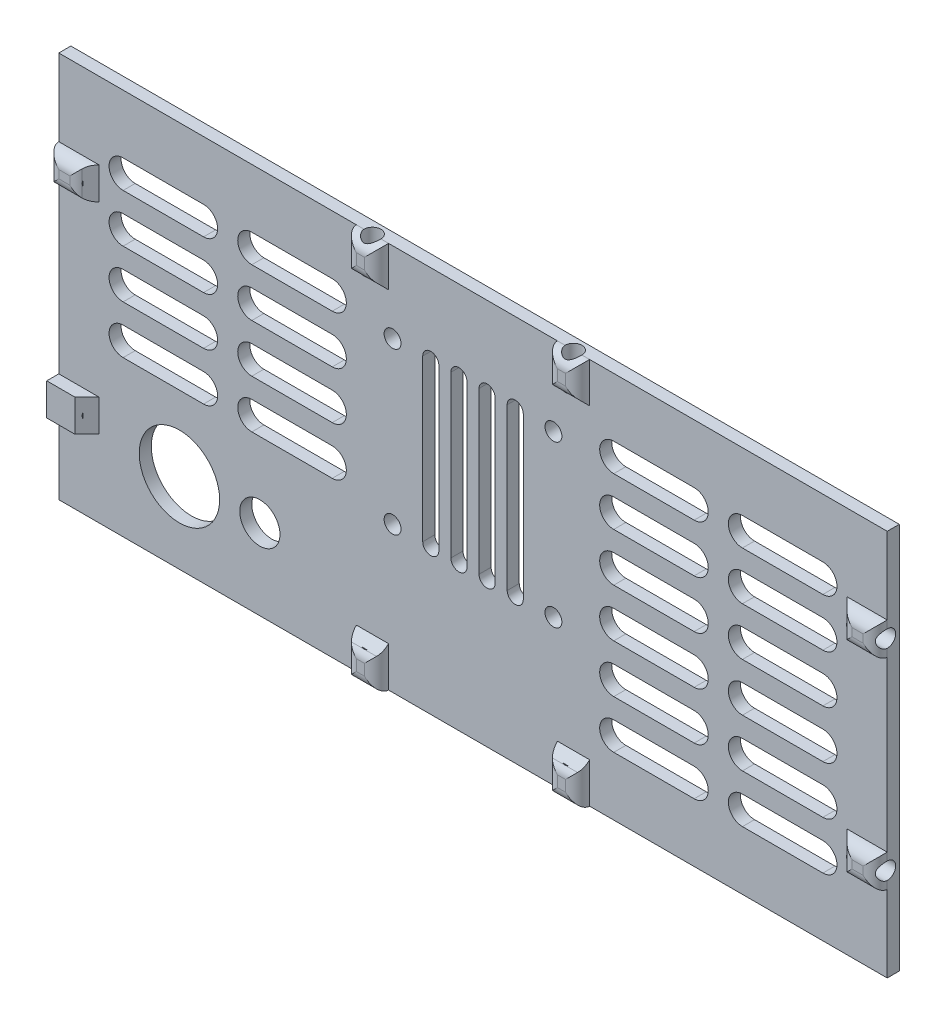
from build123d import *

# Parameters (mm, degrees)
SKETCH1_W           = 96.2019
SKETCH1_H           = 206
SKETCH1_R           = 2.1
SKETCH1_R_2         = 10
SKETCH1_R_3         = 5
BOSS_EXTRUDE1_DEPTH = 3
BOSS_EXTRUDE6_DEPTH = 10
BOSS_EXTRUDE7_START = -96.2019
BOSS_EXTRUDE7_DEPTH = 10
BOSS_EXTRUDE3_DEPTH = 10
BOSS_EXTRUDE4_START = -206
BOSS_EXTRUDE4_DEPTH = 10
CUT_EXTRUDE4_START  = -206
CUT_EXTRUDE4_DEPTH  = 8
CUT_EXTRUDE5_START  = -8
CUT_EXTRUDE5_DEPTH  = 8
CUT_EXTRUDE6_DEPTH  = 8
CUT_EXTRUDE7_START  = -88.2019
CUT_EXTRUDE7_DEPTH  = 8
CHAMFER1_SIZE       = 3
FILLET1_R           = 3


# Some blends are built 0.0001 mm under size
with BuildPart() as part:
    # Sketch1 → Boss-Extrude1 (new body)
    with BuildSketch(Plane(origin=(0, 0, 0), x_dir=(0, 1, 0), z_dir=(0, 0, 1))):
        with Locations((48.10095, 103)):
            Rectangle(SKETCH1_W, SKETCH1_H)
        with Locations(Location((36.2019, 123, 0), (0, 0, 270))):
            Circle(SKETCH1_R, mode=Mode.SUBTRACT)
        with Locations(Location((76.2019, 123, 0), (0, 0, 270))):
            Circle(SKETCH1_R, mode=Mode.SUBTRACT)
        with Locations(Location((36.2019, 83, 0), (0, 0, 270))):
            Circle(SKETCH1_R, mode=Mode.SUBTRACT)
        with Locations(Location((76.2019, 83, 0), (0, 0, 270))):
            Circle(SKETCH1_R, mode=Mode.SUBTRACT)
        with Locations(Location((20, 176, 0), (0, 0, 270))):
            Circle(SKETCH1_R_2, mode=Mode.SUBTRACT)
        with Locations(Location((20, 156, 0), (0, 0, 270))):
            Circle(SKETCH1_R_3, mode=Mode.SUBTRACT)
        with BuildLine():
            Line((36.2019, 115.5), (76.2019, 115.5))
            ThreePointArc((76.2019, 115.5), (78.2019, 113.5), (76.2019, 111.5))
            Line((76.2019, 111.5), (36.2019, 111.5))
            ThreePointArc((36.2019, 111.5), (34.2019, 113.5), (36.2019, 115.5))
        make_face(mode=Mode.SUBTRACT)
        with BuildLine():
            Line((36.2019, 108.5), (76.2019, 108.5))
            ThreePointArc((76.2019, 108.5), (78.2019, 106.5), (76.2019, 104.5))
            Line((76.2019, 104.5), (36.2019, 104.5))
            ThreePointArc((36.2019, 104.5), (34.2019, 106.5), (36.2019, 108.5))
        make_face(mode=Mode.SUBTRACT)
        with BuildLine():
            Line((36.2019, 101.5), (76.2019, 101.5))
            ThreePointArc((76.2019, 101.5), (78.2019, 99.5), (76.2019, 97.5))
            Line((76.2019, 97.5), (36.2019, 97.5))
            ThreePointArc((36.2019, 97.5), (34.2019, 99.5), (36.2019, 101.5))
        make_face(mode=Mode.SUBTRACT)
        with BuildLine():
            Line((36.2019, 94.5), (76.2019, 94.5))
            ThreePointArc((76.2019, 94.5), (78.2019, 92.5), (76.2019, 90.5))
            Line((76.2019, 90.5), (36.2019, 90.5))
            ThreePointArc((36.2019, 90.5), (34.2019, 92.5), (36.2019, 94.5))
        make_face(mode=Mode.SUBTRACT)
        with BuildLine():
            Line((21.60095, 68), (21.60095, 48))
            ThreePointArc((21.60095, 48), (18.10095, 44.5), (14.60095, 48))
            Line((14.60095, 48), (14.60095, 68))
            ThreePointArc((14.60095, 68), (18.10095, 71.5), (21.60095, 68))
        make_face(mode=Mode.SUBTRACT)
        with BuildLine():
            Line((33.60095, 68), (33.60095, 48))
            ThreePointArc((33.60095, 48), (30.10095, 44.5), (26.60095, 48))
            Line((26.60095, 48), (26.60095, 68))
            ThreePointArc((26.60095, 68), (30.10095, 71.5), (33.60095, 68))
        make_face(mode=Mode.SUBTRACT)
        with BuildLine():
            Line((45.60095, 68), (45.60095, 48))
            ThreePointArc((45.60095, 48), (42.10095, 44.5), (38.60095, 48))
            Line((38.60095, 48), (38.60095, 68))
            ThreePointArc((38.60095, 68), (42.10095, 71.5), (45.60095, 68))
        make_face(mode=Mode.SUBTRACT)
        with BuildLine():
            Line((57.60095, 68), (57.60095, 48))
            ThreePointArc((57.60095, 48), (54.10095, 44.5), (50.60095, 48))
            Line((50.60095, 48), (50.60095, 68))
            ThreePointArc((50.60095, 68), (54.10095, 71.5), (57.60095, 68))
        make_face(mode=Mode.SUBTRACT)
        with BuildLine():
            Line((69.60095, 68), (69.60095, 48))
            ThreePointArc((69.60095, 48), (66.10095, 44.5), (62.60095, 48))
            Line((62.60095, 48), (62.60095, 68))
            ThreePointArc((62.60095, 68), (66.10095, 71.5), (69.60095, 68))
        make_face(mode=Mode.SUBTRACT)
        with BuildLine():
            Line((81.60095, 68), (81.60095, 48))
            ThreePointArc((81.60095, 48), (78.10095, 44.5), (74.60095, 48))
            Line((74.60095, 48), (74.60095, 68))
            ThreePointArc((74.60095, 68), (78.10095, 71.5), (81.60095, 68))
        make_face(mode=Mode.SUBTRACT)
        with BuildLine():
            Line((21.60095, 16), (21.60095, 36))
            ThreePointArc((21.60095, 36), (18.10095, 39.5), (14.60095, 36))
            Line((14.60095, 36), (14.60095, 16))
            ThreePointArc((14.60095, 16), (18.10095, 12.5), (21.60095, 16))
        make_face(mode=Mode.SUBTRACT)
        with BuildLine():
            Line((33.60095, 16), (33.60095, 36))
            ThreePointArc((33.60095, 36), (30.10095, 39.5), (26.60095, 36))
            Line((26.60095, 36), (26.60095, 16))
            ThreePointArc((26.60095, 16), (30.10095, 12.5), (33.60095, 16))
        make_face(mode=Mode.SUBTRACT)
        with BuildLine():
            Line((45.60095, 16), (45.60095, 36))
            ThreePointArc((45.60095, 36), (42.10095, 39.5), (38.60095, 36))
            Line((38.60095, 36), (38.60095, 16))
            ThreePointArc((38.60095, 16), (42.10095, 12.5), (45.60095, 16))
        make_face(mode=Mode.SUBTRACT)
        with BuildLine():
            Line((57.60095, 16), (57.60095, 36))
            ThreePointArc((57.60095, 36), (54.10095, 39.5), (50.60095, 36))
            Line((50.60095, 36), (50.60095, 16))
            ThreePointArc((50.60095, 16), (54.10095, 12.5), (57.60095, 16))
        make_face(mode=Mode.SUBTRACT)
        with BuildLine():
            Line((69.60095, 16), (69.60095, 36))
            ThreePointArc((69.60095, 36), (66.10095, 39.5), (62.60095, 36))
            Line((62.60095, 36), (62.60095, 16))
            ThreePointArc((62.60095, 16), (66.10095, 12.5), (69.60095, 16))
        make_face(mode=Mode.SUBTRACT)
        with BuildLine():
            Line((81.60095, 16), (81.60095, 36))
            ThreePointArc((81.60095, 36), (78.10095, 39.5), (74.60095, 36))
            Line((74.60095, 36), (74.60095, 16))
            ThreePointArc((74.60095, 16), (78.10095, 12.5), (81.60095, 16))
        make_face(mode=Mode.SUBTRACT)
        with BuildLine():
            Line((45.60095, 138), (45.60095, 158))
            ThreePointArc((45.60095, 158), (42.10095, 161.5), (38.60095, 158))
            Line((38.60095, 158), (38.60095, 138))
            ThreePointArc((38.60095, 138), (42.10095, 134.5), (45.60095, 138))
        make_face(mode=Mode.SUBTRACT)
        with BuildLine():
            Line((57.60095, 138), (57.60095, 158))
            ThreePointArc((57.60095, 158), (54.10095, 161.5), (50.60095, 158))
            Line((50.60095, 158), (50.60095, 138))
            ThreePointArc((50.60095, 138), (54.10095, 134.5), (57.60095, 138))
        make_face(mode=Mode.SUBTRACT)
        with BuildLine():
            Line((69.60095, 138), (69.60095, 158))
            ThreePointArc((69.60095, 158), (66.10095, 161.5), (62.60095, 158))
            Line((62.60095, 158), (62.60095, 138))
            ThreePointArc((62.60095, 138), (66.10095, 134.5), (69.60095, 138))
        make_face(mode=Mode.SUBTRACT)
        with BuildLine():
            Line((81.60095, 138), (81.60095, 158))
            ThreePointArc((81.60095, 158), (78.10095, 161.5), (74.60095, 158))
            Line((74.60095, 158), (74.60095, 138))
            ThreePointArc((74.60095, 138), (78.10095, 134.5), (81.60095, 138))
        make_face(mode=Mode.SUBTRACT)
        with BuildLine():
            Line((45.60095, 190), (45.60095, 170))
            ThreePointArc((45.60095, 170), (42.10095, 166.5), (38.60095, 170))
            Line((38.60095, 170), (38.60095, 190))
            ThreePointArc((38.60095, 190), (42.10095, 193.5), (45.60095, 190))
        make_face(mode=Mode.SUBTRACT)
        with BuildLine():
            Line((57.60095, 190), (57.60095, 170))
            ThreePointArc((57.60095, 170), (54.10095, 166.5), (50.60095, 170))
            Line((50.60095, 170), (50.60095, 190))
            ThreePointArc((50.60095, 190), (54.10095, 193.5), (57.60095, 190))
        make_face(mode=Mode.SUBTRACT)
        with BuildLine():
            Line((69.60095, 190), (69.60095, 170))
            ThreePointArc((69.60095, 170), (66.10095, 166.5), (62.60095, 170))
            Line((62.60095, 170), (62.60095, 190))
            ThreePointArc((62.60095, 190), (66.10095, 193.5), (69.60095, 190))
        make_face(mode=Mode.SUBTRACT)
        with BuildLine():
            Line((81.60095, 190), (81.60095, 170))
            ThreePointArc((81.60095, 170), (78.10095, 166.5), (74.60095, 170))
            Line((74.60095, 170), (74.60095, 190))
            ThreePointArc((74.60095, 190), (78.10095, 193.5), (81.60095, 190))
        make_face(mode=Mode.SUBTRACT)
    extrude(amount=BOSS_EXTRUDE1_DEPTH)

    # Sketch2<4> → Boss-Extrude6 (add)
    with BuildSketch(Plane.XZ):
        with BuildLine():
            Line((-82, 6), (-82, 3))
            Line((-82, 3), (-80.1, 3))
            ThreePointArc((-80.1, 3), (-78, 5.1), (-75.9, 3))
            Line((-75.9, 3), (-74, 3))
            Line((-74, 3), (-74, 6))
            Line((-74, 6), (-82, 6))
        make_face()
        with BuildLine():
            Line((-80.1, 3), (-82, 3))
            Line((-82, 3), (-82, 0))
            Line((-82, 0), (-74, 0))
            Line((-74, 0), (-74, 3))
            Line((-74, 3), (-75.9, 3))
            ThreePointArc((-75.9, 3), (-78, 0.9), (-80.1, 3))
        make_face()
        with BuildLine():
            Line((-75.9, 3), (-80.1, 3))
            ThreePointArc((-80.1, 3), (-78, 0.9), (-75.9, 3))
        make_face()
        with BuildLine():
            ThreePointArc((-75.9, 3), (-78, 5.1), (-80.1, 3))
            Line((-80.1, 3), (-75.9, 3))
        make_face()
        with BuildLine():
            Line((-124, 6), (-132, 6))
            Line((-132, 6), (-132, 3))
            Line((-132, 3), (-130.1, 3))
            ThreePointArc((-130.1, 3), (-128, 5.1), (-125.9, 3))
            Line((-125.9, 3), (-124, 3))
            Line((-124, 3), (-124, 6))
        make_face()
        with BuildLine():
            Line((-130.1, 3), (-132, 3))
            Line((-132, 3), (-132, 0))
            Line((-132, 0), (-124, 0))
            Line((-124, 0), (-124, 3))
            Line((-124, 3), (-125.9, 3))
            ThreePointArc((-125.9, 3), (-128, 0.9), (-130.1, 3))
        make_face()
        with BuildLine():
            Line((-125.9, 3), (-130.1, 3))
            ThreePointArc((-130.1, 3), (-128, 0.9), (-125.9, 3))
        make_face()
        with BuildLine():
            ThreePointArc((-125.9, 3), (-128, 5.1), (-130.1, 3))
            Line((-130.1, 3), (-125.9, 3))
        make_face()
    extrude(amount=-BOSS_EXTRUDE6_DEPTH)

    # Sketch2 → Boss-Extrude7 (add)
    with BuildSketch(Plane.XZ.offset(BOSS_EXTRUDE7_START)):
        with BuildLine():
            Line((-124, 6), (-132, 6))
            Line((-132, 6), (-132, 3))
            Line((-132, 3), (-130.1, 3))
            ThreePointArc((-130.1, 3), (-128, 5.1), (-125.9, 3))
            Line((-125.9, 3), (-124, 3))
            Line((-124, 3), (-124, 6))
        make_face()
        with BuildLine():
            Line((-130.1, 3), (-132, 3))
            Line((-132, 3), (-132, 0))
            Line((-132, 0), (-124, 0))
            Line((-124, 0), (-124, 3))
            Line((-124, 3), (-125.9, 3))
            ThreePointArc((-125.9, 3), (-128, 0.9), (-130.1, 3))
        make_face()
        with BuildLine():
            Line((-125.9, 3), (-130.1, 3))
            ThreePointArc((-130.1, 3), (-128, 0.9), (-125.9, 3))
        make_face()
        with BuildLine():
            ThreePointArc((-125.9, 3), (-128, 5.1), (-130.1, 3))
            Line((-130.1, 3), (-125.9, 3))
        make_face()
        with BuildLine():
            Line((-80.1, 3), (-82, 3))
            Line((-82, 3), (-82, 0))
            Line((-82, 0), (-74, 0))
            Line((-74, 0), (-74, 3))
            Line((-74, 3), (-75.9, 3))
            ThreePointArc((-75.9, 3), (-78, 0.9), (-80.1, 3))
        make_face()
        with BuildLine():
            Line((-75.9, 3), (-80.1, 3))
            ThreePointArc((-80.1, 3), (-78, 0.9), (-75.9, 3))
        make_face()
        with BuildLine():
            ThreePointArc((-75.9, 3), (-78, 5.1), (-80.1, 3))
            Line((-80.1, 3), (-75.9, 3))
        make_face()
        with BuildLine():
            Line((-82, 6), (-82, 3))
            Line((-82, 3), (-80.1, 3))
            ThreePointArc((-80.1, 3), (-78, 5.1), (-75.9, 3))
            Line((-75.9, 3), (-74, 3))
            Line((-74, 3), (-74, 6))
            Line((-74, 6), (-82, 6))
        make_face()
    extrude(amount=BOSS_EXTRUDE7_DEPTH)

    # Sketch3<3> → Boss-Extrude3 (add)
    with BuildSketch(Plane.YZ):
        with BuildLine():
            Line((69.10095, 6), (69.10095, 3))
            Line((69.10095, 3), (71.00095, 3))
            ThreePointArc((71.00095, 3), (73.10095, 5.1), (75.20095, 3))
            Line((75.20095, 3), (77.10095, 3))
            Line((77.10095, 3), (77.10095, 6))
            Line((77.10095, 6), (69.10095, 6))
        make_face()
        with BuildLine():
            Line((71.00095, 3), (69.10095, 3))
            Line((69.10095, 3), (69.10095, 0))
            Line((69.10095, 0), (77.10095, 0))
            Line((77.10095, 0), (77.10095, 3))
            Line((77.10095, 3), (75.20095, 3))
            ThreePointArc((75.20095, 3), (73.10095, 0.9), (71.00095, 3))
        make_face()
        with BuildLine():
            Line((75.20095, 3), (71.00095, 3))
            ThreePointArc((71.00095, 3), (73.10095, 0.9), (75.20095, 3))
        make_face()
        with BuildLine():
            ThreePointArc((75.20095, 3), (73.10095, 5.1), (71.00095, 3))
            Line((71.00095, 3), (75.20095, 3))
        make_face()
        with BuildLine():
            Line((27.10095, 6), (19.10095, 6))
            Line((19.10095, 6), (19.10095, 3))
            Line((19.10095, 3), (21.00095, 3))
            ThreePointArc((21.00095, 3), (23.10095, 5.1), (25.20095, 3))
            Line((25.20095, 3), (27.10095, 3))
            Line((27.10095, 3), (27.10095, 6))
        make_face()
        with BuildLine():
            Line((21.00095, 3), (19.10095, 3))
            Line((19.10095, 3), (19.10095, 0))
            Line((19.10095, 0), (27.10095, 0))
            Line((27.10095, 0), (27.10095, 3))
            Line((27.10095, 3), (25.20095, 3))
            ThreePointArc((25.20095, 3), (23.10095, 0.9), (21.00095, 3))
        make_face()
        with BuildLine():
            Line((25.20095, 3), (21.00095, 3))
            ThreePointArc((21.00095, 3), (23.10095, 0.9), (25.20095, 3))
        make_face()
        with BuildLine():
            ThreePointArc((25.20095, 3), (23.10095, 5.1), (21.00095, 3))
            Line((21.00095, 3), (25.20095, 3))
        make_face()
    extrude(amount=-BOSS_EXTRUDE3_DEPTH)

    # Sketch3 → Boss-Extrude4 (add)
    with BuildSketch(Plane.YZ.offset(BOSS_EXTRUDE4_START)):
        with BuildLine():
            Line((27.10095, 6), (19.10095, 6))
            Line((19.10095, 6), (19.10095, 3))
            Line((19.10095, 3), (21.00095, 3))
            ThreePointArc((21.00095, 3), (23.10095, 5.1), (25.20095, 3))
            Line((25.20095, 3), (27.10095, 3))
            Line((27.10095, 3), (27.10095, 6))
        make_face()
        with BuildLine():
            Line((21.00095, 3), (19.10095, 3))
            Line((19.10095, 3), (19.10095, 0))
            Line((19.10095, 0), (27.10095, 0))
            Line((27.10095, 0), (27.10095, 3))
            Line((27.10095, 3), (25.20095, 3))
            ThreePointArc((25.20095, 3), (23.10095, 0.9), (21.00095, 3))
        make_face()
        with BuildLine():
            Line((25.20095, 3), (21.00095, 3))
            ThreePointArc((21.00095, 3), (23.10095, 0.9), (25.20095, 3))
        make_face()
        with BuildLine():
            ThreePointArc((25.20095, 3), (23.10095, 5.1), (21.00095, 3))
            Line((21.00095, 3), (25.20095, 3))
        make_face()
        with BuildLine():
            Line((69.10095, 6), (69.10095, 3))
            Line((69.10095, 3), (71.00095, 3))
            ThreePointArc((71.00095, 3), (73.10095, 5.1), (75.20095, 3))
            Line((75.20095, 3), (77.10095, 3))
            Line((77.10095, 3), (77.10095, 6))
            Line((77.10095, 6), (69.10095, 6))
        make_face()
        with BuildLine():
            Line((71.00095, 3), (69.10095, 3))
            Line((69.10095, 3), (69.10095, 0))
            Line((69.10095, 0), (77.10095, 0))
            Line((77.10095, 0), (77.10095, 3))
            Line((77.10095, 3), (75.20095, 3))
            ThreePointArc((75.20095, 3), (73.10095, 0.9), (71.00095, 3))
        make_face()
        with BuildLine():
            Line((75.20095, 3), (71.00095, 3))
            ThreePointArc((71.00095, 3), (73.10095, 0.9), (75.20095, 3))
        make_face()
        with BuildLine():
            ThreePointArc((75.20095, 3), (73.10095, 5.1), (71.00095, 3))
            Line((71.00095, 3), (75.20095, 3))
        make_face()
    extrude(amount=BOSS_EXTRUDE4_DEPTH)

    # Sketch3<2> → Cut-Extrude4 (cut)
    with BuildSketch(Plane.YZ.offset(CUT_EXTRUDE4_START)):
        with BuildLine():
            Line((25.20095, 3), (21.00095, 3))
            ThreePointArc((21.00095, 3), (23.10095, 0.9), (25.20095, 3))
        make_face()
        with BuildLine():
            ThreePointArc((25.20095, 3), (23.10095, 5.1), (21.00095, 3))
            Line((21.00095, 3), (25.20095, 3))
        make_face()
        with BuildLine():
            Line((75.20095, 3), (71.00095, 3))
            ThreePointArc((71.00095, 3), (73.10095, 0.9), (75.20095, 3))
        make_face()
        with BuildLine():
            ThreePointArc((75.20095, 3), (73.10095, 5.1), (71.00095, 3))
            Line((71.00095, 3), (75.20095, 3))
        make_face()
    extrude(amount=CUT_EXTRUDE4_DEPTH, mode=Mode.SUBTRACT)

    # Sketch3<5> → Cut-Extrude5 (cut)
    with BuildSketch(Plane.YZ.offset(CUT_EXTRUDE5_START)):
        with BuildLine():
            Line((25.20095, 3), (21.00095, 3))
            ThreePointArc((21.00095, 3), (23.10095, 0.9), (25.20095, 3))
        make_face()
        with BuildLine():
            ThreePointArc((25.20095, 3), (23.10095, 5.1), (21.00095, 3))
            Line((21.00095, 3), (25.20095, 3))
        make_face()
        with BuildLine():
            Line((75.20095, 3), (71.00095, 3))
            ThreePointArc((71.00095, 3), (73.10095, 0.9), (75.20095, 3))
        make_face()
        with BuildLine():
            ThreePointArc((75.20095, 3), (73.10095, 5.1), (71.00095, 3))
            Line((71.00095, 3), (75.20095, 3))
        make_face()
    extrude(amount=CUT_EXTRUDE5_DEPTH, mode=Mode.SUBTRACT)

    # Sketch2<6> → Cut-Extrude6 (cut)
    with BuildSketch(Plane.XZ):
        with BuildLine():
            Line((-75.9, 3), (-80.1, 3))
            ThreePointArc((-80.1, 3), (-78, 0.9), (-75.9, 3))
        make_face()
        with BuildLine():
            ThreePointArc((-75.9, 3), (-78, 5.1), (-80.1, 3))
            Line((-80.1, 3), (-75.9, 3))
        make_face()
        with BuildLine():
            Line((-125.9, 3), (-130.1, 3))
            ThreePointArc((-130.1, 3), (-128, 0.9), (-125.9, 3))
        make_face()
        with BuildLine():
            ThreePointArc((-125.9, 3), (-128, 5.1), (-130.1, 3))
            Line((-130.1, 3), (-125.9, 3))
        make_face()
    extrude(amount=-CUT_EXTRUDE6_DEPTH, mode=Mode.SUBTRACT)

    # Sketch2<7> → Cut-Extrude7 (cut)
    with BuildSketch(Plane.XZ.offset(CUT_EXTRUDE7_START)):
        with BuildLine():
            Line((-75.9, 3), (-80.1, 3))
            ThreePointArc((-80.1, 3), (-78, 0.9), (-75.9, 3))
        make_face()
        with BuildLine():
            ThreePointArc((-75.9, 3), (-78, 5.1), (-80.1, 3))
            Line((-80.1, 3), (-75.9, 3))
        make_face()
        with BuildLine():
            Line((-125.9, 3), (-130.1, 3))
            ThreePointArc((-130.1, 3), (-128, 0.9), (-125.9, 3))
        make_face()
        with BuildLine():
            ThreePointArc((-125.9, 3), (-128, 5.1), (-130.1, 3))
            Line((-130.1, 3), (-125.9, 3))
        make_face()
    extrude(amount=-CUT_EXTRUDE7_DEPTH, mode=Mode.SUBTRACT)

    # Chamfer1
    chamfer1_edges = [part.edges().sort_by_distance(p)[0] for p in [
        (-78, 86.2019, 6),
        (-78, 10, 6),
        (-128, 10, 6),
        (-128, 86.2019, 6),
        (-10, 73.10095, 6),
        (-10, 23.10095, 6),
        (-196, 73.10095, 6),
        (-196, 23.10095, 6),
    ]]
    chamfer(chamfer1_edges, length=CHAMFER1_SIZE - 0.0001)  # a hair under: the kernel refuses the full size

    # Fillet1
    # the kernel refuses this fillet: 3 mm, written as the material it takes off along each edge
    with BuildSketch(Plane(origin=(-66.5, 96.2019, 6), x_dir=(0, 0, -1), z_dir=(-1, 0, 0)), Plane(origin=(-116.5, 96.2019, 6), x_dir=(0, 0, -1), z_dir=(-1, 0, 0)), Plane(origin=(-206, 84.60095, 6), x_dir=(0, 0, -1), z_dir=(0, -1, 0)), Plane(origin=(0, 34.60095, 6), x_dir=(-1, 0, 0), z_dir=(0, -1, 0))) as fillet1_piece_1:
        with BuildLine():
            CenterArc((FILLET1_R, FILLET1_R), FILLET1_R, 180, 90)
            Line((0, FILLET1_R), (0, 0))
            Line((0, 0), (FILLET1_R, 0))
        make_face()
    extrude(amount=23, mode=Mode.SUBTRACT)
    with BuildSketch(Plane(origin=(-74, 103.7019, 6), x_dir=(0, 0, -1), z_dir=(0, -1, 0)), Plane(origin=(-124, 103.7019, 6), x_dir=(0, 0, -1), z_dir=(0, -1, 0)), Plane(origin=(-213.5, 77.10095, 6), x_dir=(0, 0, -1), z_dir=(1, 0, 0)), Plane(origin=(-132, -7.5, 6), x_dir=(0, 0, -1), z_dir=(0, 1, 0)), Plane(origin=(-82, -7.5, 6), x_dir=(0, 0, -1), z_dir=(0, 1, 0)), Plane(origin=(7.5, 69.10095, 6), x_dir=(0, 0, -1), z_dir=(-1, 0, 0)), Plane(origin=(7.5, 19.10095, 6), x_dir=(0, 0, -1), z_dir=(-1, 0, 0)), Plane(origin=(7.5, 27.10095, 6), x_dir=(0, -1, 0), z_dir=(-1, 0, 0))) as fillet1_piece_2:
        with BuildLine():
            CenterArc((FILLET1_R, -FILLET1_R), FILLET1_R, 90, 90)
            Line((0, -FILLET1_R), (0, 0))
            Line((0, 0), (FILLET1_R, 0))
        make_face()
    extrude(amount=22.0001, mode=Mode.SUBTRACT)
    with BuildSketch(Plane(origin=(-70.893398282, 89.2018, 6), x_dir=(0, 1, 0), z_dir=(-1, 0, 0)), Plane(origin=(-120.893398282, 89.2018, 6), x_dir=(0, 1, 0), z_dir=(-1, 0, 0)), Plane(origin=(-198.9999, 80.207551718, 6), x_dir=(-1, 0, 0), z_dir=(0, -1, 0)), Plane(origin=(-7.0001, 30.207551718, 6), x_dir=(-0.7071067811865468, 0, -0.7071067811865482), z_dir=(0, -1, 0))) as fillet1_piece_3:
        with BuildLine():
            CenterArc((FILLET1_R * 0.414213562373, FILLET1_R), FILLET1_R, 225, 45)
            Line((-FILLET1_R * 0.292893218813, FILLET1_R * 0.292893218813), (0, 0))
            Line((0, 0), (FILLET1_R * 0.414213562373, 0))
        make_face()
    extrude(amount=14.213203436, mode=Mode.SUBTRACT)
    with BuildSketch(Plane(origin=(-82, 103.7019, 6), x_dir=(0, 0, -1), z_dir=(0, -1, 0)), Plane(origin=(-132, 103.7019, 6), x_dir=(0, 0, -1), z_dir=(0, -1, 0)), Plane(origin=(-213.5, 69.10095, 6), x_dir=(0, 0, -1), z_dir=(1, 0, 0)), Plane(origin=(-124, -7.5, 6), x_dir=(0, 0, -1), z_dir=(0, 1, 0)), Plane(origin=(-74, -7.5, 6), x_dir=(0, 0, -1), z_dir=(0, 1, 0)), Plane(origin=(7.5, 77.10095, 6), x_dir=(0, 0, -1), z_dir=(-1, 0, 0))) as fillet1_piece_4:
        with BuildLine():
            CenterArc((FILLET1_R, FILLET1_R), FILLET1_R, 180, 90)
            Line((0, FILLET1_R), (0, 0))
            Line((0, 0), (FILLET1_R, 0))
        make_face()
    extrude(amount=22.0001, mode=Mode.SUBTRACT)
    with BuildSketch(Plane(origin=(-116.5, 0, 6), x_dir=(0, 0, -1), z_dir=(-1, 0, 0)), Plane(origin=(-66.5, 0, 6), x_dir=(0, 0, -1), z_dir=(-1, 0, 0)), Plane(origin=(0, 84.60095, 6), x_dir=(0, 0, -1), z_dir=(0, -1, 0))) as fillet1_piece_5:
        with BuildLine():
            CenterArc((FILLET1_R, -FILLET1_R), FILLET1_R, 90, 90)
            Line((0, -FILLET1_R), (0, 0))
            Line((0, 0), (FILLET1_R, 0))
        make_face()
    extrude(amount=23, mode=Mode.SUBTRACT)
    with BuildSketch(Plane(origin=(-120.893398282, 7.0001, 6), x_dir=(0, -1, 0), z_dir=(-1, 0, 0)), Plane(origin=(-70.893398282, 7.0001, 6), x_dir=(0, -1, 0), z_dir=(-1, 0, 0)), Plane(origin=(-7.0001, 80.207551718, 6), x_dir=(1, 0, 0), z_dir=(0, -1, 0))) as fillet1_piece_6:
        with BuildLine():
            CenterArc((FILLET1_R * 0.414213562373, -FILLET1_R), FILLET1_R, 90, 45)
            Line((-FILLET1_R * 0.292893218813, -FILLET1_R * 0.292893218813), (0, 0))
            Line((0, 0), (FILLET1_R * 0.414213562373, 0))
        make_face()
    extrude(amount=14.213203436, mode=Mode.SUBTRACT)


solid = part.part
